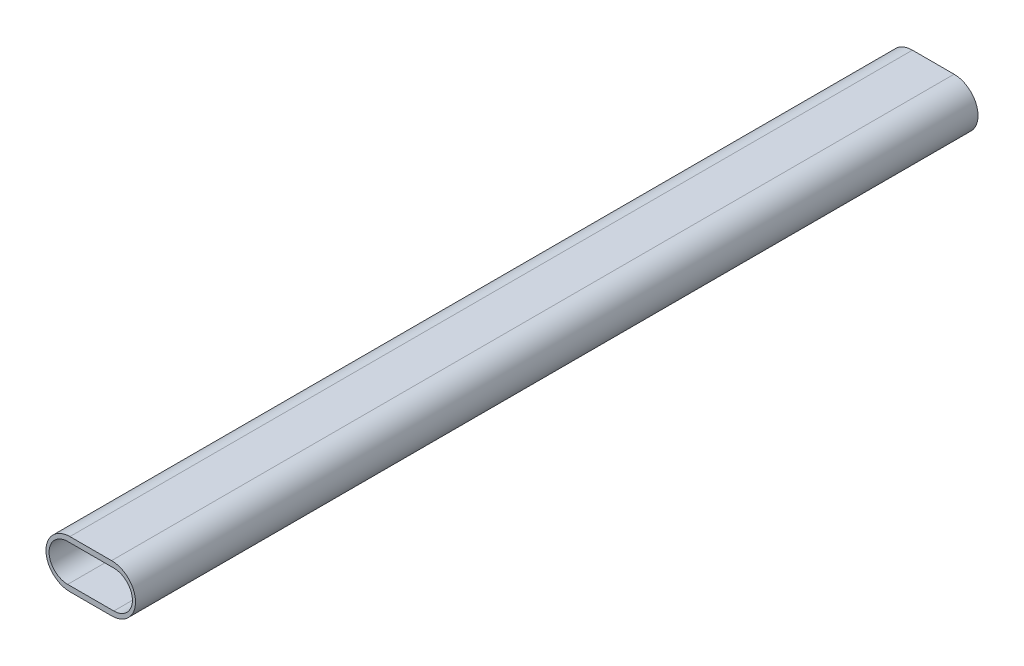
from build123d import *

# Parameters (mm, degrees)
BOSS_EXTRUDE1_DEPTH     = 273.05
CUT_EXTRUDE1_DEPTH      = 274.544539335
CUT_EXTRUDE1_DEPTH_BACK = 274.544539335


with BuildPart() as part:
    # Sketch1 → Boss-Extrude1 (new body)
    with BuildSketch(Plane.XY):
        with BuildLine():
            Line((-6.75, 7.75), (6.75, 7.75))
            ThreePointArc((6.75, 7.75), (14.5, 0), (6.75, -7.75))
            Line((6.75, -7.75), (-6.75, -7.75))
            ThreePointArc((-6.75, -7.75), (-14.5, 0), (-6.75, 7.75))
        make_face()
    extrude(amount=BOSS_EXTRUDE1_DEPTH)

    # Sketch2 → Cut-Extrude1 (cut, two sides: drawn at the far end of the back side and taken through both)
    with BuildSketch(Plane.XY.offset(273.05).offset(-CUT_EXTRUDE1_DEPTH_BACK)):
        with BuildLine():
            Line((-7.475, 6.025), (7.475, 6.025))
            ThreePointArc((7.475, 6.025), (13.5, 0), (7.475, -6.025))
            Line((7.475, -6.025), (-7.475, -6.025))
            ThreePointArc((-7.475, -6.025), (-13.5, 0), (-7.475, 6.025))
        make_face()
    extrude(amount=CUT_EXTRUDE1_DEPTH + CUT_EXTRUDE1_DEPTH_BACK, mode=Mode.SUBTRACT)


solid = part.part
